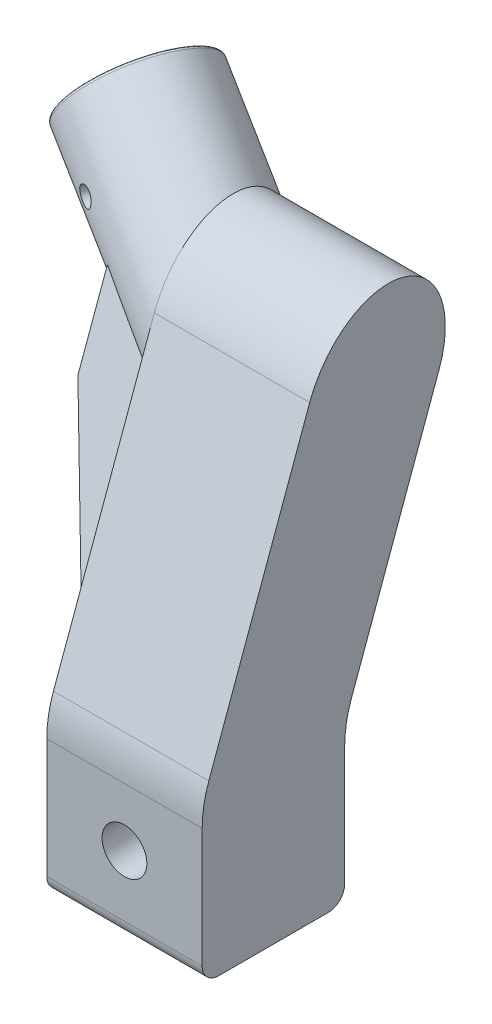
from build123d import *

# Parameters (mm, degrees)
BOSS_EXTRUDE1_REACH      = 74.329
SKETCH2_R                = 12.05
SKETCH2_R_2              = 10.05
CUT_EXTRUDE4_DEPTH       = 46.545290868
CUT_EXTRUDE4_DEPTH_BACK  = 46.545290868
SKETCH15_R               = 1.7
BOSS_EXTRUDE2_DEPTH      = 28.098
CUT_EXTRUDE2_DEPTH       = 89.015709675
CUT_EXTRUDE2_DEPTH_BACK  = 7.874
SKETCH10_R               = 11.074
CUT_EXTRUDE3_DEPTH       = 91.516093532
CUT_EXTRUDE3_DEPTH_BACK  = 91.516093532
SKETCH11_R               = 4.05
FILLET8_R                = 20
FILLET9_R                = 3
FILLET10_R               = 0.5
BOSS_EXTRUDE6_DEPTH      = 9
BOSS_EXTRUDE7_REACH      = 77.404
BOSS_EXTRUDE7_END_RADIUS = 12.05


with BuildPart() as part:
    # Boss-Extrude1: up to this plane
    boss_extrude1_end = Plane(origin=(0, 0, 0), z_dir=(1, 0, 0))
    # Sketch2 → Boss-Extrude1 (new, up to the surface)
    with BuildSketch(Plane(origin=(-23.42336176, 16.693219235, -8.525406467), x_dir=(-0.02154662406054557, -0.4785369331050924, -0.8778030226912903), z_dir=(-0.7807787253289631, 0.556440641176915, -0.28418021556805023)), mode=Mode.PRIVATE) as boss_extrude1_sk1:
        Circle(SKETCH2_R)
        Circle(SKETCH2_R_2, mode=Mode.SUBTRACT)
    boss_extrude1_tool1 = split(extrude(boss_extrude1_sk1.sketch, amount=-BOSS_EXTRUDE1_REACH, mode=Mode.PRIVATE), bisect_by=boss_extrude1_end, keep=Keep.BOTH, mode=Mode.PRIVATE)
    add(boss_extrude1_tool1.solids().sort_by_distance((-23.171069, 22.296492, 1.752942))[0])

    # Sketch15 → Cut-Extrude4 (cut, two sides: drawn at the far end of the back side and taken through both)
    with BuildSketch(Plane(origin=(0, 0, 0), x_dir=(0, -1, 0), z_dir=(0.34202014332566943, 0, -0.9396926207859081)).offset(-CUT_EXTRUDE4_DEPTH_BACK)):
        with Locations((-9.815196373, 14.656231132)):
            Circle(SKETCH15_R)
    extrude(amount=CUT_EXTRUDE4_DEPTH + CUT_EXTRUDE4_DEPTH_BACK, mode=Mode.SUBTRACT)

    # Sketch4 → Boss-Extrude2 (add)
    with BuildSketch(Plane(origin=(0, 0, 0), x_dir=(0, 0, -1), z_dir=(1, 0, 0))):
        with BuildLine():
            Line((-5.371607806, -50.159926765), (11.69794914, -3.261704495))
            add(Edge.make_bspline(
                [(11.69794914, -3.261704495), (13.023530174, 0.380299464), (13.632350175, 4.931939522), (12.576039762, 9.319831777), (9.889212943, 12.278993802), (6.672591547, 13.921756918), (6.321061701, 14.078649753), (5.966410111, 14.215688364), (5.610041679, 14.333545448), (1.94451841, 15.355592439), (-2.645051043, 14.989019805), (-7.184008082, 11.997704508), (-10.212120347, 7.343985553), (-11.69794914, 3.261704495)],
                knots=[4.869563815, 4.869563815, 4.869563815, 4.869563815, 4.869563815, 4.869563815, 6.27094857, 6.27094857, 6.27094857, 6.27094857, 6.440360142, 6.440360142, 6.440360142, 6.440360142, 8.011156469, 8.011156469, 8.011156469, 8.011156469, 8.011156469, 8.011156469], degree=5, weights=[1, 1, 0.97874069, 0.976075616, 1, 1, 1.000000809, 1.000001243, 1, 1, 0.965685425, 0.965685425, 1, 1]))
            Line((-11.69794914, 3.261704495), (-31.141832785, -50.159926765))
            Line((-31.141832785, -50.159926765), (-31.141832785, -78.259926765))
            Line((-31.141832785, -78.259926765), (-5.371607806, -78.259926765))
            Line((-5.371607806, -78.259926765), (-5.371607806, -50.159926765))
        make_face()
    extrude(amount=BOSS_EXTRUDE2_DEPTH)

    # Sketch10 → Cut-Extrude2 (cut, two sides: drawn at the far end of the back side and taken through both)
    with BuildSketch(Plane(origin=(0, 0, 5.371607806), x_dir=(-1, 0, 0), z_dir=(0, 0, -1)).offset(-CUT_EXTRUDE2_DEPTH_BACK)):
        with Locations((-14.049, -64.209926765)):
            Circle(SKETCH10_R)
    extrude(amount=CUT_EXTRUDE2_DEPTH + CUT_EXTRUDE2_DEPTH_BACK, mode=Mode.SUBTRACT)

    # Sketch11 → Cut-Extrude3 (cut, two sides: drawn at the far end of the back side and taken through both)
    with BuildSketch(Plane(origin=(0, 0, 13.245607806), x_dir=(-1, 0, 0), z_dir=(0, 0, -1)).offset(-CUT_EXTRUDE3_DEPTH_BACK)):
        with Locations((-14.049, -64.209926765)):
            Circle(SKETCH11_R)
    extrude(amount=CUT_EXTRUDE3_DEPTH + CUT_EXTRUDE3_DEPTH_BACK, mode=Mode.SUBTRACT)

    # Fillet8
    fillet8_edges = [part.edges().sort_by_distance(p)[0] for p in [
        (14.049, -50.159926765, 5.371607806),
        (14.049, -50.159926765, 31.141832785),
    ]]
    fillet(fillet8_edges, radius=FILLET8_R)

    # Fillet9
    fillet9_edges = [part.edges().sort_by_distance(p)[0] for p in [
        (14.049, -78.259926765, 5.371607806),
        (14.049, -78.259926765, 31.141832785),
    ]]
    fillet(fillet9_edges, radius=FILLET9_R)

    # Fillet10
    fillet10_edges = [part.edges().sort_by_distance(p)[0] for p in [
        (-23.16372494, 22.459589279, 2.052119956),
        (-23.206818188, 21.502515413, 0.296513911),
    ]]
    fillet(fillet10_edges, radius=FILLET10_R)

    # Sketch12 → Boss-Extrude6 (add, symmetric)
    with BuildSketch(Plane(origin=(0, 0, 0), x_dir=(1, 0, 0), z_dir=(0, -0.3420201433256694, -0.9396926207859082))):
        Polygon((0, 47.783566), (0, 15.387813246), (-11.791089719, 15.387813246), align=None)
    extrude(amount=BOSS_EXTRUDE6_DEPTH, both=True)

    # Boss-Extrude7: up to this cylinder (the profile starts outside it)
    boss_extrude7_end = Plane(origin=(3.855904321, -2.748002479, 1.403434399), z_dir=(-0.7807787253289631, 0.556440641176915, -0.28418021556805023)) * Cylinder(BOSS_EXTRUDE7_END_RADIUS, 179.908, mode=Mode.PRIVATE)
    # Sketch13 → Boss-Extrude7 (add, up to the surface)
    with BuildSketch(Plane(origin=(0, -14.459814557, 5.262942092), x_dir=(1, 0, 0), z_dir=(0, 0.9396926207859082, -0.34202014332566927)), mode=Mode.PRIVATE) as boss_extrude7_sk1:
        Polygon((-11.791089719, -9), (0, -9), (0, -0.736448912), (0, 9), (-11.791089719, 9), align=None)
    boss_extrude7_tool1 = extrude(boss_extrude7_sk1.sketch, amount=BOSS_EXTRUDE7_REACH, mode=Mode.PRIVATE) - boss_extrude7_end
    add(boss_extrude7_tool1.solids().sort_by_distance((-5.895545, -14.459815, 5.262942))[0])


solid = part.part
